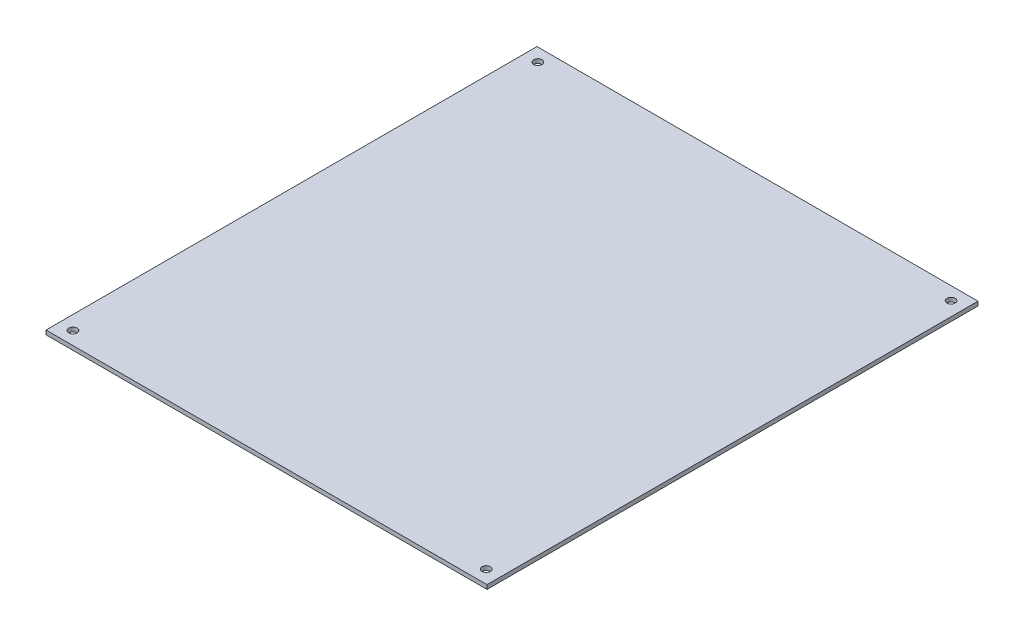
from build123d import *

# Parameters (mm, degrees)
SKETCH1_W           = 212
SKETCH1_H           = 236
BOSS_EXTRUDE1_DEPTH = 2
SKETCH2_R           = 2
CUT_EXTRUDE1_DEPTH  = 159.631648797


with BuildPart() as part:
    # Sketch1 → Boss-Extrude1 (new body)
    with BuildSketch(Plane(origin=(0, 0, 0), x_dir=(1, 0, 0), z_dir=(0, 1, 0))):
        Rectangle(SKETCH1_W, SKETCH1_H)
    extrude(amount=BOSS_EXTRUDE1_DEPTH)

    # Sketch2 → Cut-Extrude1 (cut, through all)
    with BuildSketch(Plane(origin=(0, 2, 0), x_dir=(1, 0, 0), z_dir=(0, 1, 0))):
        with Locations((99.321819194, 111.737046593)):
            Circle(SKETCH2_R)
        with Locations((-99.321819194, 111.737046593)):
            Circle(SKETCH2_R)
        with Locations((-99.321819194, -111.737046593)):
            Circle(SKETCH2_R)
        with Locations((99.321819194, -111.737046593)):
            Circle(SKETCH2_R)
    extrude(amount=-CUT_EXTRUDE1_DEPTH, mode=Mode.SUBTRACT)


solid = part.part
